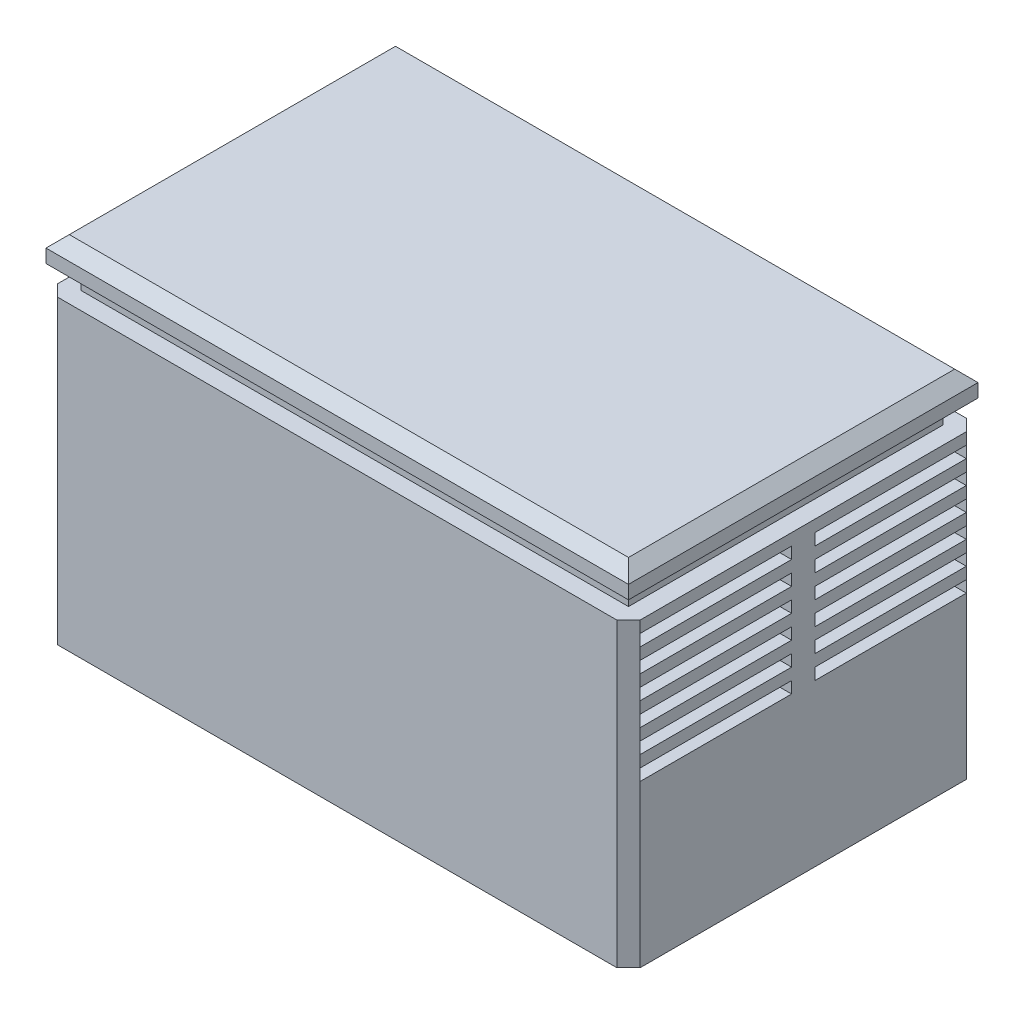
from build123d import *

# Parameters (mm, degrees)
BOSS_EXTRUDE1_DEPTH = 300
SKETCH2_W           = 15
SKETCH2_H           = 10
CUT_EXTRUDE1_DEPTH  = 603.07972894
SKETCH4_W           = 130
SKETCH4_H           = 10
CUT_EXTRUDE2_DEPTH  = 30
SKETCH7_W           = 130
SKETCH7_H           = 10
CUT_EXTRUDE3_DEPTH  = 30
CHAMFER1_SIZE       = 10
CHAMFER2_SIZE       = 10
CHAMFER3_SIZE       = 10
SKETCH8_R           = 5
CUT_EXTRUDE4_DEPTH  = 30


with BuildPart() as part:
    # Sketch1 → Boss-Extrude1 (new body)
    with BuildSketch(Plane.XY):
        Polygon((250, 118.480565371), (235, 118.480565371), (235, 108.480565371), (250, 108.480565371), (250, -150), (-250, -150), (-250, 108.480565371), (-235, 108.480565371), (-235, 118.480565371), (-250, 118.480565371), (-250, 150), (250, 150), align=None)
    extrude(amount=BOSS_EXTRUDE1_DEPTH)

    # Sketch2 → Cut-Extrude1 (cut, through all)
    with BuildSketch(Plane.ZY.offset(250)):
        with Locations((292.5, 113.480565371)):
            Rectangle(SKETCH2_W, SKETCH2_H)
        with Locations((7.5, 113.480565371)):
            Rectangle(SKETCH2_W, SKETCH2_H)
    extrude(amount=-CUT_EXTRUDE1_DEPTH, mode=Mode.SUBTRACT)

    # Sketch4 → Cut-Extrude2 (cut)
    with BuildSketch(Plane.ZY.offset(250)):
        with Locations((75, 93.480565371)):
            Rectangle(SKETCH4_W, SKETCH4_H)
        with Locations((225, 93.480565371)):
            Rectangle(SKETCH4_W, SKETCH4_H)
        with Locations((225, 73.480565371)):
            Rectangle(SKETCH4_W, SKETCH4_H)
        with Locations((225, 53.480565371)):
            Rectangle(SKETCH4_W, SKETCH4_H)
        with Locations((225, 33.480565371)):
            Rectangle(SKETCH4_W, SKETCH4_H)
        with Locations((225, 13.480565371)):
            Rectangle(SKETCH4_W, SKETCH4_H)
        with Locations((225, -6.519434629)):
            Rectangle(SKETCH4_W, SKETCH4_H)
        with Locations((75, 73.480565371)):
            Rectangle(SKETCH4_W, SKETCH4_H)
        with Locations((75, 53.480565371)):
            Rectangle(SKETCH4_W, SKETCH4_H)
        with Locations((75, 33.480565371)):
            Rectangle(SKETCH4_W, SKETCH4_H)
        with Locations((75, 13.480565371)):
            Rectangle(SKETCH4_W, SKETCH4_H)
        with Locations((75, -6.519434629)):
            Rectangle(SKETCH4_W, SKETCH4_H)
    extrude(amount=-CUT_EXTRUDE2_DEPTH, mode=Mode.SUBTRACT)

    # Sketch7 → Cut-Extrude3 (cut)
    with BuildSketch(Plane(origin=(250, 0, 0), x_dir=(0, 0, -1), z_dir=(1, 0, 0))):
        with Locations((-225, 93.480565371)):
            Rectangle(SKETCH7_W, SKETCH7_H)
        with Locations((-75, 93.480565371)):
            Rectangle(SKETCH7_W, SKETCH7_H)
        with Locations((-75, 73.480565371)):
            Rectangle(SKETCH7_W, SKETCH7_H)
        with Locations((-75, 53.480565371)):
            Rectangle(SKETCH7_W, SKETCH7_H)
        with Locations((-75, 33.480565371)):
            Rectangle(SKETCH7_W, SKETCH7_H)
        with Locations((-75, 13.480565371)):
            Rectangle(SKETCH7_W, SKETCH7_H)
        with Locations((-75, -6.519434629)):
            Rectangle(SKETCH7_W, SKETCH7_H)
        with Locations((-225, 73.480565371)):
            Rectangle(SKETCH7_W, SKETCH7_H)
        with Locations((-225, 53.480565371)):
            Rectangle(SKETCH7_W, SKETCH7_H)
        with Locations((-225, 33.480565371)):
            Rectangle(SKETCH7_W, SKETCH7_H)
        with Locations((-225, 13.480565371)):
            Rectangle(SKETCH7_W, SKETCH7_H)
        with Locations((-225, -6.519434629)):
            Rectangle(SKETCH7_W, SKETCH7_H)
    extrude(amount=-CUT_EXTRUDE3_DEPTH, mode=Mode.SUBTRACT)

    # Chamfer1
    chamfer1_edges = [part.edges().sort_by_distance(p)[0] for p in [
        (0, 150, 0),
        (-250, 150, 150),
        (250, 150, 150),
        (0, 150, 300),
    ]]
    chamfer(chamfer1_edges, length=CHAMFER1_SIZE)

    # Chamfer2
    chamfer2_edges = [part.edges().sort_by_distance(p)[0] for p in [
        (0, 118.480565371, 0),
        (-250, 118.480565371, 150),
        (250, 118.480565371, 150),
        (0, 118.480565371, 300),
    ]]
    chamfer(chamfer2_edges, length=CHAMFER2_SIZE)

    # Chamfer3
    chamfer3_edges = [part.edges().sort_by_distance(p)[0] for p in [
        (250, -20.759717314, 300),
        (250, -20.759717314, 0),
        (-250, -20.759717314, 0),
        (-250, -20.759717314, 300),
    ]]
    chamfer(chamfer3_edges, length=CHAMFER3_SIZE - 0.0001)  # a hair under: the kernel refuses the full size

    # Sketch8 → Cut-Extrude4 (cut)
    with BuildSketch(Plane.XZ.offset(150)):
        with Locations((-215, 35)):
            Circle(SKETCH8_R)
        with Locations((-215, 265)):
            Circle(SKETCH8_R)
        with Locations((0, 265)):
            Circle(SKETCH8_R)
        with Locations((0, 35)):
            Circle(SKETCH8_R)
    extrude(amount=-CUT_EXTRUDE4_DEPTH, mode=Mode.SUBTRACT)


solid = part.part
